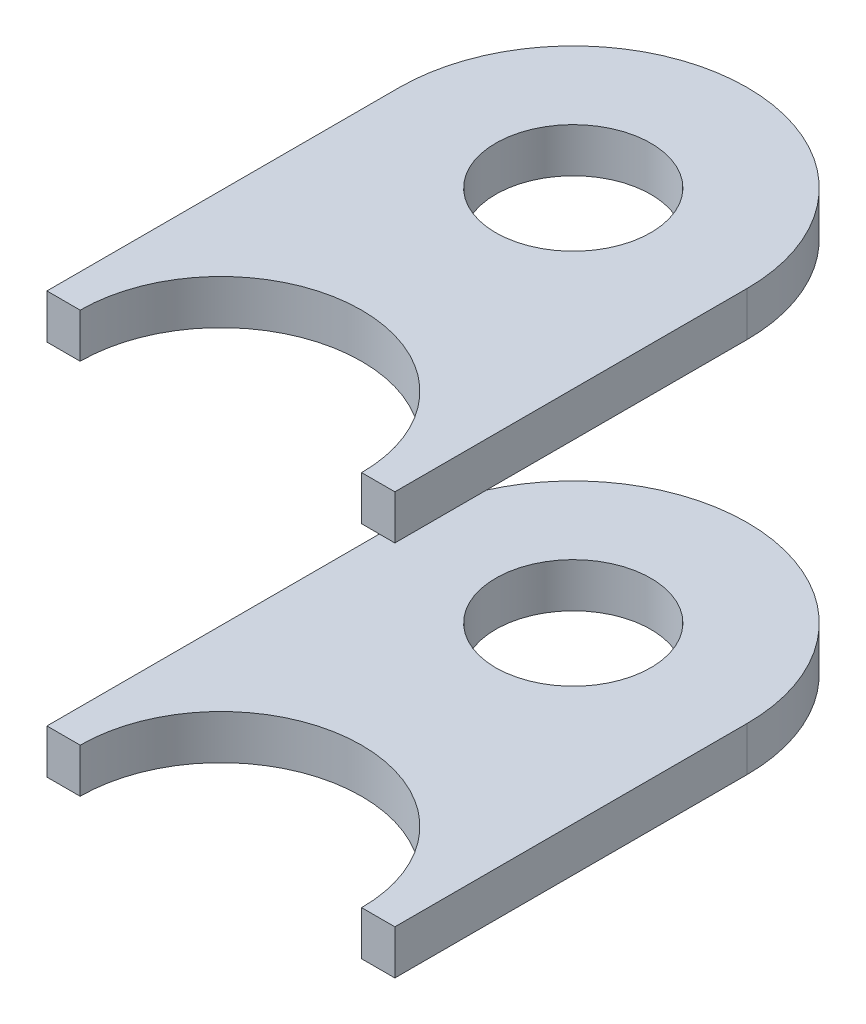
from build123d import *

# Parameters (mm, degrees)
SKETCH1_R           = 7
BOSS_EXTRUDE1_DEPTH = 4


with BuildPart() as part:
    # Sketch1 → Boss-Extrude1 (new body)
    with BuildSketch(Plane(origin=(0, 15, 0), x_dir=(1, 0, 0), z_dir=(0, 1, 0))):
        with BuildLine():
            Line((15.7, -31.8), (12.7, -31.8))
            ThreePointArc((12.7, -31.8), (0, -19.1), (-12.7, -31.8))
            Line((-12.7, -31.8), (-15.7, -31.8))
            Line((-15.7, -31.8), (-15.7, 0))
            ThreePointArc((-15.7, 0), (0, 15.7), (15.7, 0))
            Line((15.7, 0), (15.7, -31.8))
        make_face()
        Circle(SKETCH1_R, mode=Mode.SUBTRACT)
    extrude(amount=BOSS_EXTRUDE1_DEPTH)


with BuildPart() as body_2:
    # Mirror1: mirrored copy
    add(part.part.mirror(Plane.ZX))


solid = Compound([part.part, body_2.part])
